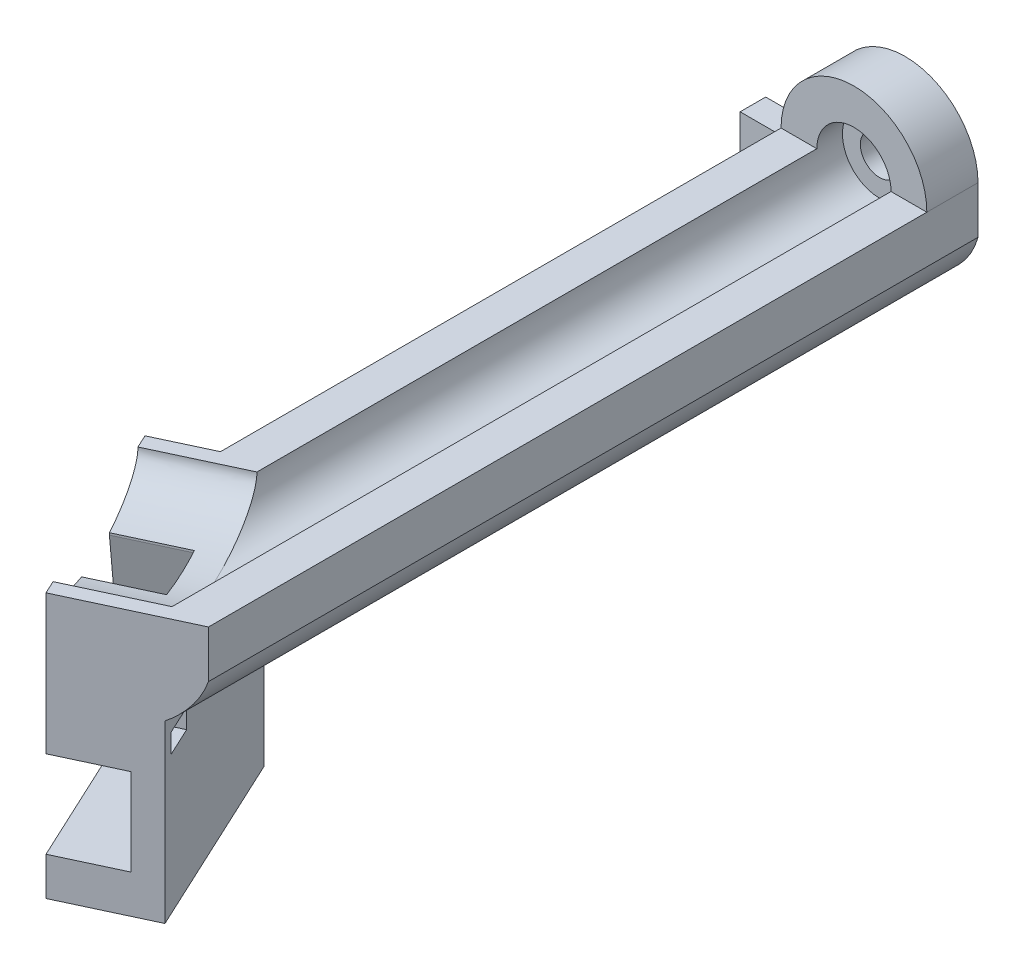
from build123d import *

# Parameters (mm, degrees)
CROQUIS1_R                = 1.5
SALIENTE_EXTRUIR1_DEPTH   = 4
CROQUIS2_R                = 2.9
CORTAR_EXTRUIR1_DEPTH     = 2
SALIENTE_EXTRUIR2_DEPTH   = 65
CORTAR_EXTRUIR2_OUTLINE_W = 7.281077338
CORTAR_EXTRUIR2_OUTLINE_H = 8.780929931
CORTAR_EXTRUIR2_DEPTH     = 8.6
CORTAR_EXTRUIR2_TAPER     = -65
CROQUIS5_W                = 41.142355125
CROQUIS5_H                = 35.377069929
CORTAR_EXTRUIR3_DEPTH     = 10
SALIENTE_EXTRUIR3_DEPTH   = 7
CORTAR_EXTRUIR4_DEPTH     = 5
CORTAR_EXTRUIR5_START     = -7
CROQUIS8_W                = 2.5
CROQUIS8_H                = 1.5
CORTAR_EXTRUIR5_DEPTH     = 7
CORTAR_EXTRUIR6_DEPTH     = 10
SALIENTE_EXTRUIR4_DEPTH   = 3.7
SALIENTE_EXTRUIR5_DEPTH   = 2.558793
CORTAR_EXTRUIR7_DEPTH     = 10
SALIENTE_EXTRUIR6_DEPTH   = 2
CROQUIS15_W               = 4
CROQUIS15_H               = 4
SALIENTE_EXTRUIR7_DEPTH   = 1
CROQUIS16_R               = 1.4
CORTAR_EXTRUIR8_DEPTH     = 1


# Read off the part's stored shape, not the designer's step: Cortar-Extruir2
with BuildPart() as part:
    # Croquis1 → Saliente-Extruir1 (new body)
    with BuildSketch(Plane.XY):
        with BuildLine():
            Line((-55.370631899, 7.045687646), (-55.370631899, 3.345687646))
            ThreePointArc((-55.370631899, 3.345687646), (-61.070631899, -0.995420457), (-66.770631899, 3.345687646))
            Line((-66.770631899, 3.345687646), (-66.770631899, 7.045687646))
            ThreePointArc((-66.770631899, 7.045687646), (-61.070631899, 12.745687646), (-55.370631899, 7.045687646))
        make_face()
        with Locations((-61.070631899, 7.045687646)):
            Circle(CROQUIS1_R, mode=Mode.SUBTRACT)
    extrude(amount=SALIENTE_EXTRUIR1_DEPTH)

    # Croquis2 → Cortar-Extruir1 (cut)
    with BuildSketch(Plane.XY.offset(4)):
        with Locations((-61.070631899, 7.045687646)):
            Circle(CROQUIS2_R)
    extrude(amount=-CORTAR_EXTRUIR1_DEPTH, mode=Mode.SUBTRACT)

    # Croquis3 → Saliente-Extruir2 (add)
    with BuildSketch(Plane.XY.offset(4)):
        with BuildLine():
            Line((-63.970631899, 7.045687646), (-66.770631899, 7.045687646))
            Line((-66.770631899, 7.045687646), (-66.770631899, 3.345687646))
            ThreePointArc((-66.770631899, 3.345687646), (-61.070631899, -0.995420457), (-55.370631899, 3.345687646))
            Line((-55.370631899, 3.345687646), (-55.370631899, 7.045687646))
            Line((-55.370631899, 7.045687646), (-58.170631899, 7.045687646))
            ThreePointArc((-58.170631899, 7.045687646), (-61.070631899, 4.145687646), (-63.970631899, 7.045687646))
        make_face()
    extrude(amount=SALIENTE_EXTRUIR2_DEPTH)

    # Cortar-Extruir2 outline → Cortar-Extruir2 (cut)
    with BuildSketch(Plane.YZ.offset(-58.170631899)):
        with Locations((3.405148977, 64.609535034)):
            Rectangle(CORTAR_EXTRUIR2_OUTLINE_W, CORTAR_EXTRUIR2_OUTLINE_H)
    extrude(amount=-CORTAR_EXTRUIR2_DEPTH, taper=CORTAR_EXTRUIR2_TAPER, mode=Mode.SUBTRACT)

    # Croquis5 → Cortar-Extruir3 (cut)
    with BuildSketch(Plane(origin=(-70.846238664, 0, 33.03614364), x_dir=(0.422618261740701, 0, 0.9063077870366493), z_dir=(-0.9063077870366493, 1.4037441023509523e-15, 0.422618261740701))):
        with Locations((23.845262034, -3.548141358)):
            Rectangle(CROQUIS5_W, CROQUIS5_H)
    extrude(amount=CORTAR_EXTRUIR3_DEPTH, mode=Mode.SUBTRACT)

    # Croquis6 → Saliente-Extruir3 (add)
    with BuildSketch(Plane(origin=(-70.846238664, 0, 33.03614364), x_dir=(0.422618261740701, 0, 0.9063077870366493), z_dir=(-0.9063077870366493, 1.4037441023509523e-15, 0.422618261740701))):
        with BuildLine():
            Line((31.131056203, 7.045687646), (29.993040795, 7.045687646))
            add(Edge.make_bspline(
                [(16.269071612, 7.045687646), (16.269071612, 4.145687646), (23.131056203, 4.145687646), (29.993040795, 4.145687646), (29.993040795, 7.045687646)],
                knots=[3.141592654, 3.141592654, 3.141592654, 4.71238898, 4.71238898, 6.283185307, 6.283185307, 6.283185307], degree=2, weights=[1, 0.707106781, 1, 0.707106781, 1]))
            Line((16.269071612, 7.045687646), (15.131056203, 7.045687646))
            Line((15.131056203, 7.045687646), (15.131056203, -13.654312354))
            Line((15.131056203, -13.654312354), (31.131056203, -13.654312354))
            Line((31.131056203, -13.654312354), (31.131056203, 7.045687646))
        make_face()
    extrude(amount=SALIENTE_EXTRUIR3_DEPTH)

    # Croquis7 → Cortar-Extruir4 (cut)
    with BuildSketch(Plane(origin=(-77.190393173, 0, 35.994471473), x_dir=(0.42261826174070094, 0, 0.9063077870366492), z_dir=(-0.9063077870366493, 1.403744102350952e-15, 0.422618261740701))):
        with BuildLine():
            Line((25.381056203, 4.145687646), (26.731056203, -3.854312354))
            Line((26.731056203, -3.854312354), (31.131056203, -3.854312354))
            Line((31.131056203, -3.854312354), (31.131056203, -10.654312354))
            Line((31.131056203, -10.654312354), (15.131056203, -10.654312354))
            Line((15.131056203, -10.654312354), (15.131056203, -3.854312354))
            Line((15.131056203, -3.854312354), (19.531056203, -3.854312354))
            Line((19.531056203, -3.854312354), (20.881056203, 4.145687646))
            Line((20.881056203, 4.145687646), (20.881056203, 4.306015013))
            add(Edge.make_bspline(
                [(20.881056203, 4.306015013), (23.131056203, 3.97597782), (25.381056203, 4.306015013)],
                knots=[4.378316067, 4.378316067, 4.378316067, 5.046461894, 5.046461894, 5.046461894], degree=2, weights=[1, 0.944714701, 1]))
            Line((25.381056203, 4.306015013), (25.381056203, 4.145687646))
        make_face()
    extrude(amount=-CORTAR_EXTRUIR4_DEPTH, mode=Mode.SUBTRACT)

    # Croquis8 → Cortar-Extruir5 (cut)
    with BuildSketch(Plane(origin=(-77.190393173, 0, 35.994471473), x_dir=(0.42261826174070094, 0, 0.9063077870366492), z_dir=(-0.9063077870366493, 1.403744102350952e-15, 0.422618261740701)).offset(CORTAR_EXTRUIR5_START)):
        with Locations((17.381056203, -2.104312354)):
            Rectangle(CROQUIS8_W, CROQUIS8_H)
        with Locations((28.881056203, -2.104312354)):
            Rectangle(CROQUIS8_W, CROQUIS8_H)
    extrude(amount=CORTAR_EXTRUIR5_DEPTH, mode=Mode.SUBTRACT)

    # Croquis9 → Cortar-Extruir6 (cut)
    with BuildSketch(Plane(origin=(0, 7.045687646, 0), x_dir=(1, 0, 0), z_dir=(0, 1, 0))):
        Polygon((-57.689685805, -61.250462296), (-55.370631899, -60.1690697), (-55.370631899, -66.223689447), align=None)
    extrude(amount=-CORTAR_EXTRUIR6_DEPTH, mode=Mode.SUBTRACT)

    # Croquis10 → Saliente-Extruir4 (add)
    with BuildSketch(Plane(origin=(0, 7.045687646, 0), x_dir=(1, 0, 0), z_dir=(0, 1, 0))):
        Polygon((-66.770631899, -41.776310553), (-66.770631899, -47.8309303), (-64.451577993, -46.749537704), align=None)
    extrude(amount=-SALIENTE_EXTRUIR4_DEPTH)

    # Croquis12 → Saliente-Extruir5 (add)
    with BuildSketch(Plane(origin=(-70.846238664, 0, 33.03614364), x_dir=(0.422618261740701, 0, 0.9063077870366493), z_dir=(-0.9063077870366493, 1.4037441023509523e-15, 0.422618261740701))):
        with BuildLine():
            Line((15.131056203, 3.345687646), (15.131056203, 0.066589345))
            ThreePointArc((15.131056203, 0.066589345), (12.129139109, 1.273987016), (9.64370718, 3.345687646))
            Line((9.64370718, 3.345687646), (15.131056203, 3.345687646))
        make_face()
    extrude(amount=SALIENTE_EXTRUIR5_DEPTH)

    # Croquis13 → Cortar-Extruir7 (cut)
    with BuildSketch(Plane(origin=(0, 3.345687646, 0), x_dir=(1, 0, 0), z_dir=(0, 1, 0))):
        Polygon((-66.770631899, -47.8309303), (-66.770631899, -41.776310553), (-69.089685805, -42.857703149), align=None)
    extrude(amount=-CORTAR_EXTRUIR7_DEPTH, mode=Mode.SUBTRACT)

    # Croquis14 → Saliente-Extruir6 (add)
    with BuildSketch(Plane(origin=(0, 0, 0), x_dir=(-1, 0, 0), z_dir=(0, 0, -1))):
        Polygon((66.770631899, 3.345687646), (70.770631899, 3.345687646), (70.770631899, 0.345687646), (66.770631899, 0.345687646), (66.770631899, -0.854312354), (71.970631899, -0.854312354), (71.970631899, 4.545687646), (66.770631899, 4.545687646), align=None)
    extrude(amount=-SALIENTE_EXTRUIR6_DEPTH)

    # Croquis15 → Saliente-Extruir7 (add)
    with BuildSketch(Plane.XZ.offset(-3.345687646)):
        with Locations((-68.770631899, 0)):
            Rectangle(CROQUIS15_W, CROQUIS15_H)
    extrude(amount=SALIENTE_EXTRUIR7_DEPTH)

    # Croquis16 → Cortar-Extruir8 (cut)
    with BuildSketch(Plane.XZ.offset(-2.345687646)):
        with Locations((-68.770631899, -2)):
            Circle(CROQUIS16_R)
    extrude(amount=-CORTAR_EXTRUIR8_DEPTH, mode=Mode.SUBTRACT)


solid = part.part
